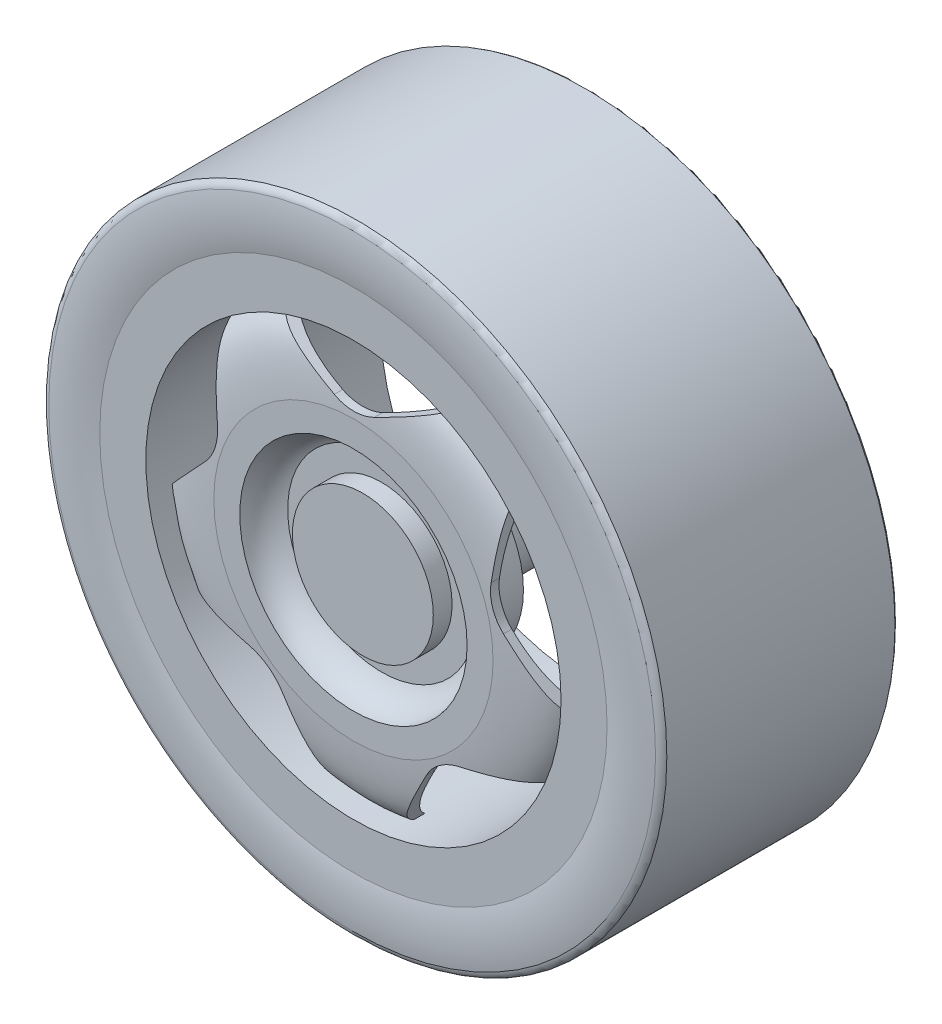
from build123d import *

# Parameters (mm, degrees)
CUT_EXTRUDE1_DEPTH    = 10
SKETCH3_R             = 6
BOSS_EXTRUDE1_DEPTH   = 25
CUT_EXTRUDE2_DEPTH    = 12
CROQUIS1_R            = 45.559859
CROQUIS1_R_2          = 33
CORTAR_EXTRUIR1_DEPTH = 40


with BuildPart() as part:
    # Sketch1 → Revolve1 (revolve)
    with BuildSketch(Plane(origin=(0, 0, 0), x_dir=(0, 0, -1), z_dir=(1, 0, 0))):
        with BuildLine():
            Line((-0.010712, 12.1), (-0.010712, 14.864338))
            add(Edge.make_bspline(
                [(2.989288, 22.1), (1.233895, 21.087391), (0.275128, 20.018956), (-0.010712, 14.864338)],
                knots=[0, 0, 0, 0, 1, 1, 1, 1], degree=3))
            Line((2.989288, 22.1), (-0.010712, 22.1))
            Line((-0.010712, 22.1), (-0.010712, 25.1))
            Line((-0.010712, 25.1), (24.989288, 25.1))
            Line((24.989288, 25.1), (24.989288, 22.1))
            Line((24.989288, 22.1), (4.086781, 22.1))
            ThreePointArc((4.086781, 22.1), (1.62229, 18.874187), (0.989288, 14.864338))
            Line((0.989288, 14.864338), (0.989288, 12.992036))
            ThreePointArc((0.989288, 12.992036), (2.931105, 11.902942), (4.086781, 10))
            Line((4.086781, 10), (8.086781, 10))
            Line((8.086781, 10), (8.086781, 0))
            Line((8.086781, 0), (0.989288, 0))
            Line((0.989288, 0), (0.989288, 7.5))
            Line((0.989288, 7.5), (2.989288, 7.5))
            Line((2.989288, 7.5), (2.989288, 10))
            ThreePointArc((2.989288, 10), (1.761669, 11.439115), (-0.010712, 12.1))
        make_face()
    revolve(axis=Axis((0, 0, 13.275868), (0, 0, -1)))

    # Sketch2 → Cut-Extrude1 (cut)
    with BuildSketch(Plane.XY.offset(0.010712)):
        with BuildLine():
            Line((-10, 19.70812), (-2.129814, 16.002742))
            ThreePointArc((-2.129814, 16.002742), (0, 15.526445), (2.129814, 16.002742))
            Line((2.129814, 16.002742), (10, 19.70812))
            ThreePointArc((10, 19.70812), (0, 22.1), (-10, 19.70812))
        make_face()
        with BuildLine():
            Line((15.653366, 15.600709), (14.561363, 6.970693))
            ThreePointArc((14.561363, 6.970693), (14.766527, 4.797935), (15.877661, 2.919546))
            Line((15.877661, 2.919546), (21.833706, -3.420421))
            ThreePointArc((21.833706, -3.420421), (21.018349, 6.829276), (15.653366, 15.600709))
        make_face()
        with BuildLine():
            Line((19.674312, -10.066352), (11.129231, -11.694617))
            ThreePointArc((11.129231, -11.694617), (9.126216, -12.561158), (7.68312, -14.198363))
            Line((7.68312, -14.198363), (3.493972, -21.822057))
            ThreePointArc((3.493972, -21.822057), (12.990054, -17.879276), (19.674312, -10.066352))
        make_face()
        with BuildLine():
            Line((-3.493972, -21.822057), (-7.68312, -14.198363))
            ThreePointArc((-7.68312, -14.198363), (-9.126216, -12.561158), (-11.129231, -11.694617))
            Line((-11.129231, -11.694617), (-19.674312, -10.066352))
            ThreePointArc((-19.674312, -10.066352), (-12.990054, -17.879276), (-3.493972, -21.822057))
        make_face()
        with BuildLine():
            Line((-21.833706, -3.420421), (-15.877661, 2.919546))
            ThreePointArc((-15.877661, 2.919546), (-14.766527, 4.797935), (-14.561363, 6.970693))
            Line((-14.561363, 6.970693), (-15.653366, 15.600709))
            ThreePointArc((-15.653366, 15.600709), (-21.018349, 6.829276), (-21.833706, -3.420421))
        make_face()
    extrude(amount=-CUT_EXTRUDE1_DEPTH, mode=Mode.SUBTRACT)

    # Sketch3 → Boss-Extrude1 (add)
    with BuildSketch(Plane(origin=(0, 0, -8.086781), x_dir=(-1, 0, 0), z_dir=(0, 0, -1))):
        Circle(SKETCH3_R)
    extrude(amount=BOSS_EXTRUDE1_DEPTH)

    # Sketch4 → Cut-Extrude2 (cut)
    with BuildSketch(Plane(origin=(0, 0, -33.086781), x_dir=(-1, 0, 0), z_dir=(0, 0, -1))):
        with BuildLine():
            Line((-2.547548, 2.4), (2.547548, 2.4))
            ThreePointArc((2.547548, 2.4), (3.5, 0), (2.547548, -2.4))
            Line((2.547548, -2.4), (-2.547548, -2.4))
            ThreePointArc((-2.547548, -2.4), (-3.5, 0), (-2.547548, 2.4))
        make_face()
    extrude(amount=-CUT_EXTRUDE2_DEPTH, mode=Mode.SUBTRACT)

    # Sketch5 → Revolve2 (revolve)
    with BuildSketch(Plane(origin=(0, 0, 0), x_dir=(0, 0, -1), z_dir=(1, 0, 0))):
        with BuildLine():
            Line((-0.010712, 27), (-0.010712, 24.918498))
            Line((-0.010712, 24.918498), (24.989288, 25.1))
            Line((24.989288, 25.1), (24.989288, 27))
            ThreePointArc((24.989288, 27), (25.309872, 29.640292), (25.125343, 32.293567))
            ThreePointArc((25.125343, 32.293567), (24.845231, 32.837576), (24.300645, 33.116565))
            ThreePointArc((24.300645, 33.116565), (18.414381, 33.817853), (12.489288, 34))
            ThreePointArc((12.489288, 34), (6.564195, 33.817853), (0.677932, 33.116565))
            ThreePointArc((0.677932, 33.116565), (0.133346, 32.837576), (-0.146767, 32.293567))
            ThreePointArc((-0.146767, 32.293567), (-0.331296, 29.640292), (-0.010712, 27))
        make_face()
    revolve(axis=Axis((0, 0, 0), (0, 0, -1)))

    # Croquis1 → Cortar-Extruir1 (cut)
    with BuildSketch(Plane.XY.offset(0.010712)):
        Circle(CROQUIS1_R)
        Circle(CROQUIS1_R_2, mode=Mode.SUBTRACT)
    extrude(amount=-CORTAR_EXTRUIR1_DEPTH, mode=Mode.SUBTRACT)


solid = part.part
